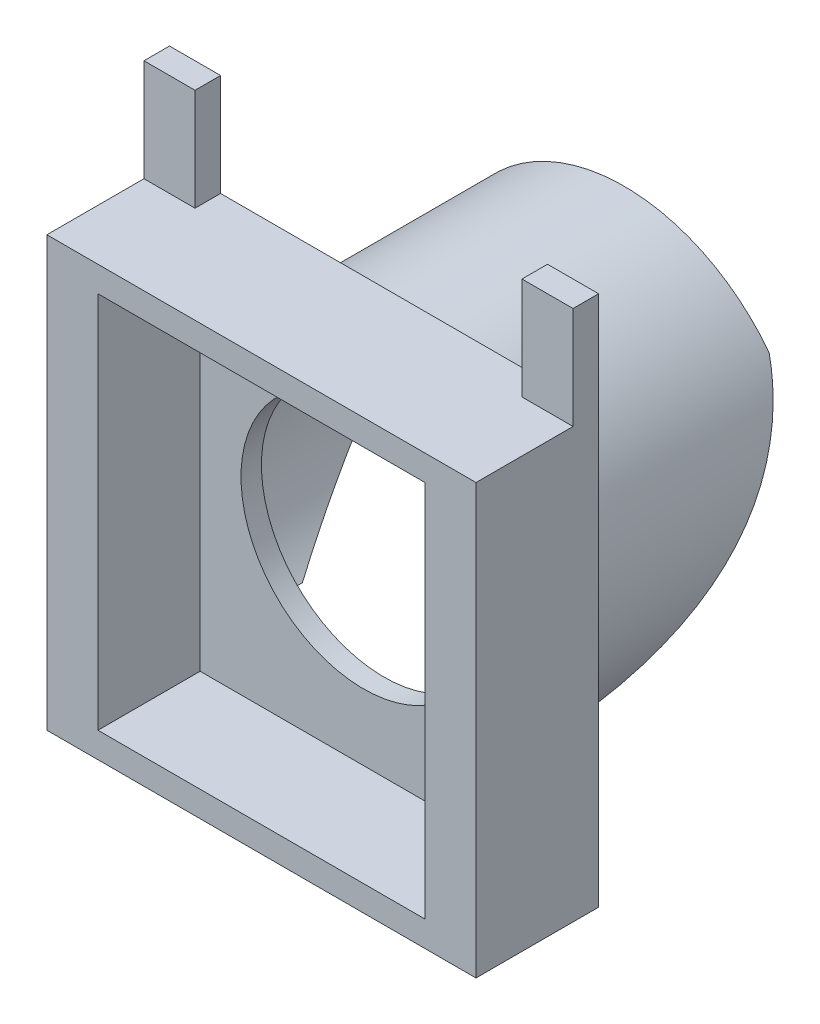
from build123d import *

# Parameters (mm, degrees)
SKETCH2_W            = 350
SKETCH2_H            = 1050
SKETCH2_R            = 100
BOSS_EXTRUDE2_DEPTH  = 100
SCALE1_SCALE         = 0.24
SKETCH6_W            = 84
SKETCH6_H            = 168
CUT_EXTRUDE3_DEPTH   = 80
SKETCH11_W           = 64
SKETCH11_H           = 74
CUT_EXTRUDE8_DEPTH   = 20
SKETCH12_W           = 10
SKETCH12_H           = 5
BOSS_EXTRUDE6_DEPTH  = 20
SKETCH13_W           = 10
SKETCH13_H           = 5
BOSS_EXTRUDE7_DEPTH  = 20
SKETCH14_W           = 10
SKETCH14_H           = 5
CUT_EXTRUDE9_DEPTH   = 40
SKETCH15_W           = 10
SKETCH15_H           = 5
CUT_EXTRUDE10_DEPTH  = 40
SKETCH16_W           = 10
SKETCH16_H           = 20
CUT_EXTRUDE11_DEPTH  = 5
SKETCH17_W           = 10
SKETCH17_H           = 20
CUT_EXTRUDE12_DEPTH  = 5
BOSS_EXTRUDE9_DEPTH  = 47
SWEEP3_START         = -9
SWEEP3_DEPTH         = 47
CUT_EXTRUDE13_DEPTH  = 82
SKETCH28_W           = 10
SKETCH28_H           = 20
BOSS_EXTRUDE10_DEPTH = 5
SKETCH29_W           = 10
SKETCH29_H           = 20
BOSS_EXTRUDE11_DEPTH = 5
SKETCH30_W           = 10
SKETCH30_H           = 5
BOSS_EXTRUDE12_DEPTH = 40
SKETCH31_W           = 10
SKETCH31_H           = 5
BOSS_EXTRUDE13_DEPTH = 40


# Read off the part's stored shape, not the designer's step: Sweep3
with BuildPart() as part:
    # Sketch2 → Boss-Extrude2 (new body)
    with BuildSketch(Plane.XY):
        with Locations((13.505164405, -303.545290931)):
            Rectangle(SKETCH2_W, SKETCH2_H)
        with Locations((13.505164405, 46.454709069)):
            Circle(SKETCH2_R, mode=Mode.SUBTRACT)
        with Locations((13.505164405, -303.545290931)):
            Circle(SKETCH2_R, mode=Mode.SUBTRACT)
        with Locations((13.505164405, -653.545290931)):
            Circle(SKETCH2_R, mode=Mode.SUBTRACT)
    extrude(amount=BOSS_EXTRUDE2_DEPTH)


with BuildPart() as part_1:
    # Scale1: scaled about (13.505164405, -303.545290931, 50)
    add(part.part.scale(SCALE1_SCALE).moved(Location((10.263924948, -230.694421108, 38))))

    # Sketch6 → Cut-Extrude3 (cut)
    with BuildSketch(Plane.XY.offset(62)):
        with Locations((13.505164405, -261.545290931)):
            Rectangle(SKETCH6_W, SKETCH6_H)
    extrude(amount=-CUT_EXTRUDE3_DEPTH, mode=Mode.SUBTRACT)

    # Sketch11 → Cut-Extrude8 (cut)
    with BuildSketch(Plane.XY.offset(62)):
        with Locations((13.505164405, -387.545290931)):
            Rectangle(SKETCH11_W, SKETCH11_H)
    extrude(amount=-CUT_EXTRUDE8_DEPTH, mode=Mode.SUBTRACT)

    # Sketch12 → Boss-Extrude6 (add)
    with BuildSketch(Plane(origin=(0, -429.545290931, 0), x_dir=(-1, 0, 0), z_dir=(0, -1, 0))):
        with Locations((23.494835595, -40.5)):
            Rectangle(SKETCH12_W, SKETCH12_H)
    extrude(amount=BOSS_EXTRUDE6_DEPTH)

    # Sketch13 → Boss-Extrude7 (add)
    with BuildSketch(Plane(origin=(0, -429.545290931, 0), x_dir=(-1, 0, 0), z_dir=(0, -1, 0))):
        with Locations((-50.505164405, -40.5)):
            Rectangle(SKETCH13_W, SKETCH13_H)
    extrude(amount=BOSS_EXTRUDE7_DEPTH)

    # Sketch14 → Cut-Extrude9 (cut)
    with BuildSketch(Plane.XZ.offset(449.545290931)):
        with Locations((-23.494835595, 40.5)):
            Rectangle(SKETCH14_W, SKETCH14_H)
    extrude(amount=-CUT_EXTRUDE9_DEPTH, mode=Mode.SUBTRACT)

    # Sketch15 → Cut-Extrude10 (cut)
    with BuildSketch(Plane(origin=(0, -449.545290931, 0), x_dir=(-1, 0, 0), z_dir=(0, -1, 0))):
        with Locations((-50.505164405, -40.5)):
            Rectangle(SKETCH15_W, SKETCH15_H)
    extrude(amount=-CUT_EXTRUDE10_DEPTH, mode=Mode.SUBTRACT)

    # Sketch16 → Cut-Extrude11 (cut)
    with BuildSketch(Plane(origin=(0, 0, 38), x_dir=(-1, 0, 0), z_dir=(0, 0, -1))):
        with Locations((23.494835595, -355.545290931)):
            Rectangle(SKETCH16_W, SKETCH16_H)
    extrude(amount=-CUT_EXTRUDE11_DEPTH, mode=Mode.SUBTRACT)

    # Sketch17 → Cut-Extrude12 (cut)
    with BuildSketch(Plane(origin=(0, 0, 38), x_dir=(-1, 0, 0), z_dir=(0, 0, -1))):
        with Locations((-50.505164405, -355.545290931)):
            Rectangle(SKETCH17_W, SKETCH17_H)
    extrude(amount=-CUT_EXTRUDE12_DEPTH, mode=Mode.SUBTRACT)

    # Sketch18 → Boss-Extrude9 (add)
    with BuildSketch(Plane(origin=(0, 0, 38), x_dir=(-1, 0, 0), z_dir=(0, 0, -1))):
        with BuildLine():
            Line((-35.671185106, -409.711311632), (-38.7770157, -412.817142227))
            ThreePointArc((-38.7770157, -412.817142227), (-13.505164405, -351.805496082), (11.766686891, -412.817142227))
            Line((11.766686891, -412.817142227), (8.660856297, -409.711311632))
            ThreePointArc((8.660856297, -409.711311632), (-13.505164405, -356.197803831), (-35.671185106, -409.711311632))
        make_face()
    extrude(amount=BOSS_EXTRUDE9_DEPTH)


with BuildPart() as body_2:
    # Sweep3 outline → Sweep3 (new body)
    with BuildSketch(Plane.XY.offset(SWEEP3_START)):
        with BuildLine():
            Line((35.671185106, -409.711311632), (38.7770157, -412.817142227))
            ThreePointArc((38.7770157, -412.817142227), (13.505164405, -351.805496082), (-11.766686891, -412.817142227))
            Line((-11.766686891, -412.817142227), (-8.660856297, -409.711311632))
            ThreePointArc((-8.660856297, -409.711311632), (13.505164404, -356.197803831), (35.671185106, -409.711311632))
        make_face()
    extrude(amount=SWEEP3_DEPTH)


with BuildPart() as cut_extrude13_tool:
    # Sketch27 → Cut-Extrude13 (new body)
    with BuildSketch(Plane.ZY.offset(28.494835595)):
        with BuildLine():
            Line((38, -412.817142227), (-9, -412.817142227))
            Line((-9, -412.817142227), (-9, -365.817142227))
            add(Edge.make_bspline(
                [(-9, -365.817142227), (5.370162337, -397.723377267), (38, -412.817142227)],
                knots=[0, 0, 0, 1, 1, 1], degree=2))
        make_face()
    extrude(amount=-CUT_EXTRUDE13_DEPTH)


with BuildPart() as part_2:
    add(part_1.part)

    # Cut-Extrude13: cut by cut_extrude13_tool
    add(cut_extrude13_tool.part, mode=Mode.SUBTRACT)



with BuildPart() as body_2_1:
    add(body_2.part)

    # Cut-Extrude13: cut by cut_extrude13_tool
    add(cut_extrude13_tool.part, mode=Mode.SUBTRACT)


with BuildPart() as part_3:
    add(part_2.part)

    add(body_2_1.part)  # Boss-Extrude10 merges body 2
    # Sketch28 → Boss-Extrude10 (add)
    with BuildSketch(Plane(origin=(0, 0, 43), x_dir=(-1, 0, 0), z_dir=(0, 0, -1))):
        with Locations((-50.505164405, -419.545290931)):
            Rectangle(SKETCH28_W, SKETCH28_H)
    extrude(amount=BOSS_EXTRUDE10_DEPTH)

    # Sketch29 → Boss-Extrude11 (add)
    with BuildSketch(Plane(origin=(0, 0, 43), x_dir=(-1, 0, 0), z_dir=(0, 0, -1))):
        with Locations((23.494835595, -419.545290931)):
            Rectangle(SKETCH29_W, SKETCH29_H)
    extrude(amount=BOSS_EXTRUDE11_DEPTH)

    # Sketch30 → Boss-Extrude12 (add)
    with BuildSketch(Plane(origin=(0, -365.545290931, 0), x_dir=(1, 0, 0), z_dir=(0, 1, 0))):
        with Locations((50.505164405, -40.5)):
            Rectangle(SKETCH30_W, SKETCH30_H)
    extrude(amount=BOSS_EXTRUDE12_DEPTH)

    # Sketch31 → Boss-Extrude13 (add)
    with BuildSketch(Plane(origin=(0, -365.545290931, 0), x_dir=(1, 0, 0), z_dir=(0, 1, 0))):
        with Locations((-23.494835595, -40.5)):
            Rectangle(SKETCH31_W, SKETCH31_H)
    extrude(amount=BOSS_EXTRUDE13_DEPTH)


solid = part_3.part
